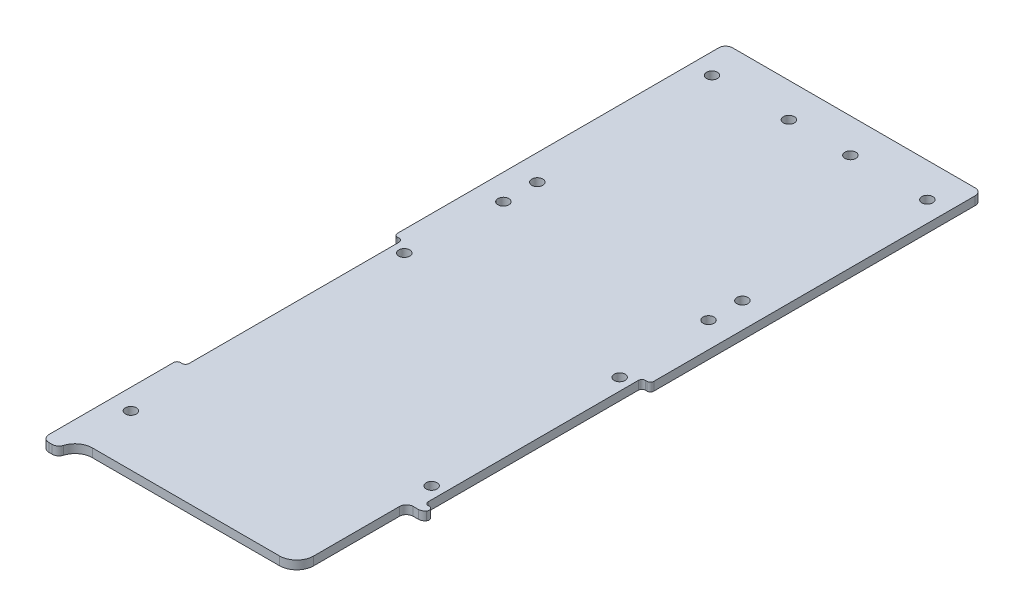
from build123d import *

# Parameters (mm, degrees)
SKETCH1_R               = 2.032
BOSS_EXTRUDE1_DEPTH     = 3.175
FILLET1_R               = 2.54
FILLET2_R               = 2.54
FILLET3_R               = 6.35
CUT_EXTRUDE1_DEPTH      = 136.673215063
FILLET4_R               = 6.35
FILLET5_R               = 2.54
SKETCH3_R               = 2.032
CUT_EXTRUDE2_DEPTH      = 136.673215063
CUT_EXTRUDE3_DEPTH      = 136.673215063
CUT_EXTRUDE3_DEPTH_BACK = 136.673215063
SKETCH4_W               = 3.175
SKETCH4_H               = 80.645
FILLET6_R               = 1.27


with BuildPart() as part:
    # Sketch1 → Boss-Extrude1 (new body)
    with BuildSketch(Plane(origin=(0, 0, 0), x_dir=(1, 0, 0), z_dir=(0, 1, 0))):
        Polygon((47.625, 127), (-47.625, 127), (-47.625, -127), (-41.275, -127), (-41.275, -120.65), (41.275, -120.65), (41.275, -127), (47.625, -127), align=None)
        with Locations((-39.999684148, -101.6)):
            Circle(SKETCH1_R, mode=Mode.SUBTRACT)
        with Locations((39.999684148, -69.85)):
            Circle(SKETCH1_R, mode=Mode.SUBTRACT)
        with Locations((-39.999684148, 0)):
            Circle(SKETCH1_R, mode=Mode.SUBTRACT)
        with Locations((-39.999684148, 114.3)):
            Circle(SKETCH1_R, mode=Mode.SUBTRACT)
        with Locations((-11.424684148, 114.3)):
            Circle(SKETCH1_R, mode=Mode.SUBTRACT)
        with Locations((39.999684148, 0)):
            Circle(SKETCH1_R, mode=Mode.SUBTRACT)
        with Locations((11.424684148, 114.3)):
            Circle(SKETCH1_R, mode=Mode.SUBTRACT)
        with Locations((39.999684148, 114.3)):
            Circle(SKETCH1_R, mode=Mode.SUBTRACT)
    extrude(amount=BOSS_EXTRUDE1_DEPTH)

    # Fillet1
    fillet1_edges = [part.edges().sort_by_distance(p)[0] for p in [
        (-47.625, 1.5875, -127),
        (47.625, 1.5875, -127),
        (47.625, 1.5875, 127),
        (-47.625, 1.5875, 127),
    ]]
    fillet(fillet1_edges, radius=FILLET1_R)

    # Fillet2
    fillet2_edges = [part.edges().sort_by_distance(p)[0] for p in [
        (41.275, 1.5875, 127),
        (-41.275, 1.5875, 127),
    ]]
    fillet(fillet2_edges, radius=FILLET2_R)

    # Fillet3
    fillet3_edges = [part.edges().sort_by_distance(p)[0] for p in [
        (41.275, 1.5875, 120.65),
        (-41.275, 1.5875, 120.65),
    ]]
    fillet(fillet3_edges, radius=FILLET3_R)

    # Sketch2 → Cut-Extrude1 (cut, through all)
    with BuildSketch(Plane.XZ):
        with BuildLine():
            Line((40.64508, 123.578690235), (40.64508, 79.88808))
            Line((40.64508, 79.88808), (47.625, 79.88808))
            Line((47.625, 79.88808), (47.625, 124.46))
            ThreePointArc((47.625, 124.46), (46.881051224, 126.256051224), (45.085, 127))
            Line((45.085, 127), (43.815, 127))
            ThreePointArc((43.815, 127), (42.297059666, 126.496530663), (41.380880287, 125.185714286))
            ThreePointArc((41.380880287, 125.185714286), (41.069166069, 124.356476684), (40.64508, 123.578690235))
        make_face()
    extrude(amount=-CUT_EXTRUDE1_DEPTH, mode=Mode.SUBTRACT)

    # Fillet4
    fillet4_edges = [part.edges().sort_by_distance(p)[0] for p in [
        (40.64508, 1.5875, 123.578690235),
    ]]
    fillet(fillet4_edges, radius=FILLET4_R)

    # Fillet5
    fillet5_edges = [part.edges().sort_by_distance(p)[0] for p in [
        (47.625, 1.5875, 79.88808),
        (40.64508, 1.5875, 79.88808),
    ]]
    fillet(fillet5_edges, radius=FILLET5_R)

    # Sketch3 → Cut-Extrude2 (cut, through all)
    with BuildSketch(Plane.XZ):
        with Locations((-38.102809353, -34.913768806)):
            Circle(SKETCH3_R)
        with Locations((-38.102809353, -47.490173279)):
            Circle(SKETCH3_R)
        with Locations((38.102809353, -47.490173279)):
            Circle(SKETCH3_R)
        with Locations((38.102809353, -34.913768806)):
            Circle(SKETCH3_R)
    extrude(amount=-CUT_EXTRUDE2_DEPTH, mode=Mode.SUBTRACT)

    # Sketch4 → Cut-Extrude3 (cut, two sides: drawn at the far end of the back side and taken through both)
    with BuildSketch(Plane(origin=(0, 3.175, 0), x_dir=(1, 0, 0), z_dir=(0, 1, 0)).offset(-CUT_EXTRUDE3_DEPTH_BACK)):
        with Locations((-46.0375, -36.5125)):
            Rectangle(SKETCH4_W, SKETCH4_H)
        with Locations((46.0375, -36.5125)):
            Rectangle(SKETCH4_W, SKETCH4_H)
    extrude(amount=CUT_EXTRUDE3_DEPTH + CUT_EXTRUDE3_DEPTH_BACK, mode=Mode.SUBTRACT)

    # Fillet6
    fillet6_edges = [part.edges().sort_by_distance(p)[0] for p in [
        (-44.45, 1.5875, -3.81),
        (-47.625, 1.5875, -3.81),
        (-47.625, 1.5875, 76.835),
        (-44.45, 1.5875, 76.835),
        (44.45, 1.5875, 76.835),
        (47.625, 1.5875, 76.835),
        (44.45, 1.5875, -3.81),
        (47.625, 1.5875, -3.81),
    ]]
    fillet(fillet6_edges, radius=FILLET6_R)


solid = part.part
